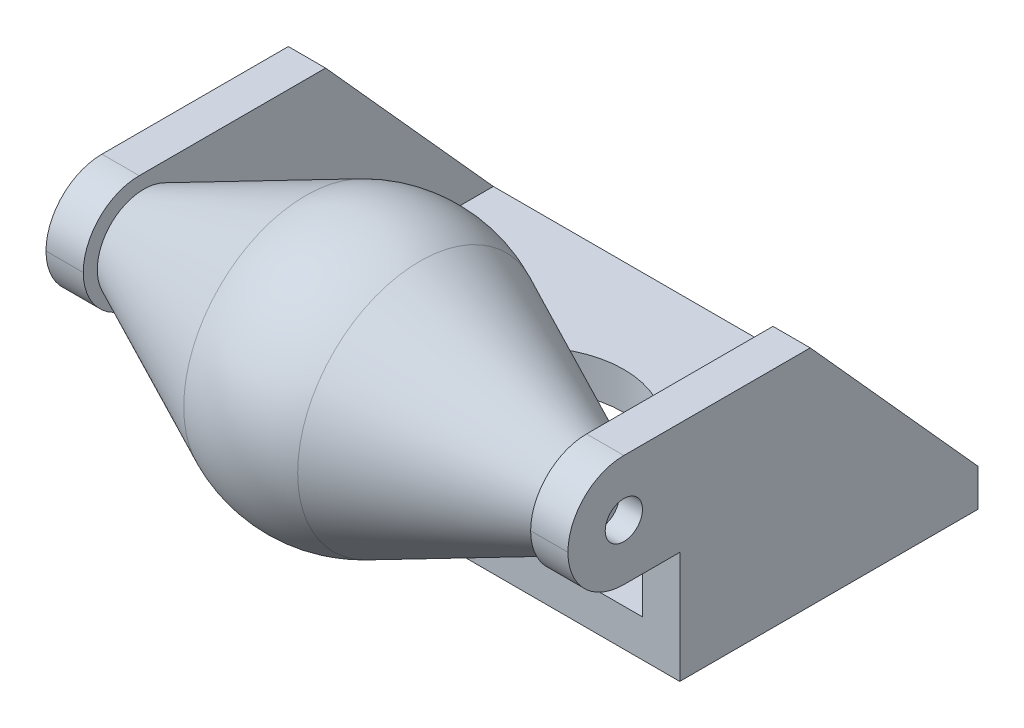
from build123d import *

# Parameters (mm, degrees)
SKETCH_1_W           = 28
SKETCH_1_H           = 16
EXTRUDE_1_DEPTH      = 2
EXTRUDE_2_DEPTH      = 2
FILLET_1_R           = 3
SKETCH_3_R           = 1
CUT_EXTRUDE_1_DEPTH  = 34.526109228
EXTRUDE_3_DEPTH      = 1
EXTRUDE_3_DEPTH_BACK = 25
SKETCH_5_R           = 1
SKETCH_6_R           = 2
SKETCH_6_R_2         = 5
CUT_EXTRUDE_2_DEPTH  = 2


with BuildPart() as part:
    # 草图1 → 凸台-拉伸1 (new body)
    with BuildSketch(Plane(origin=(0, 0, 0), x_dir=(1, 0, 0), z_dir=(0, 1, 0))):
        Rectangle(SKETCH_1_W, SKETCH_1_H)
    extrude(amount=EXTRUDE_1_DEPTH)

    # 草图2 → 凸台-拉伸2 (add)
    with BuildSketch(Plane.ZY.offset(14)):
        Polygon((-8, 0), (-8, 2), (1, 12), (14, 12), (14, 6), (8, 6), (8, 2), (8, 0), align=None)
    extrude_2 = extrude(amount=-EXTRUDE_2_DEPTH)

    # 镜向1: 凸台-拉伸2 across plane
    add(extrude_2.mirror(Plane(origin=(0, 0, 0), x_dir=(0, 0, 1), z_dir=(1, 0, 0))))

    # 圆角1
    fillet_1_edges = [part.edges().sort_by_distance(p)[0] for p in [
        (13, 6, 14),
        (13, 12, 14),
        (-13, 6, 14),
        (-13, 12, 14),
    ]]
    fillet(fillet_1_edges, radius=FILLET_1_R - 0.0001)  # a hair under: the kernel refuses the full size

    # 草图3 → 切除-拉伸1 (cut, through all)
    with BuildSketch(Plane.ZY.offset(14)):
        with Locations((11, 9)):
            Circle(SKETCH_3_R)
    extrude(amount=-CUT_EXTRUDE_1_DEPTH, mode=Mode.SUBTRACT)



with BuildPart() as body_2:
    # 草图4 → 旋转2 (revolve)
    with BuildSketch(Plane(origin=(0, 9, 0), x_dir=(1, 0, 0), z_dir=(0, 1, 0))):
        with BuildLine():
            Line((-11.75, -11), (-11.75, -13.5))
            Line((-11.75, -13.5), (-3.056178347, -17.553995615))
            ThreePointArc((-3.056178347, -17.553995615), (0, -18.231534043), (3.056178347, -17.553995615))
            Line((3.056178347, -17.553995615), (11.75, -13.5))
            Line((11.75, -13.5), (11.75, -11))
            Line((11.75, -11), (-11.75, -11))
        make_face()
    revolve(axis=Axis((14, 9, 11), (-1, 0, 0)))


with BuildPart() as part_1:
    add(part.part)

    add(body_2.part)  # 凸台-拉伸3 merges body 2
    # 草图5 → 凸台-拉伸3 (add, two sides: drawn at the far end of the back side and taken through both)
    with BuildSketch(Plane(origin=(11.75, 0, 0), x_dir=(0, 0, -1), z_dir=(1, 0, 0)).offset(-EXTRUDE_3_DEPTH_BACK)):
        with Locations(Location((-11, 9, 0), (0, 0, 180))):
            Circle(SKETCH_5_R)
    extrude(amount=EXTRUDE_3_DEPTH + EXTRUDE_3_DEPTH_BACK)

    # 草图6 → 切除-拉伸2 (cut)
    with BuildSketch(Plane.XZ):
        with Locations(Location((-8, 2, 0), (0, 0, 270))):
            Circle(SKETCH_6_R)
        with Locations(Location((8, 2, 0), (0, 0, 270))):
            Circle(SKETCH_6_R)
        with Locations(Location((0, 2, 0), (0, 0, 270))):
            Circle(SKETCH_6_R_2)
    extrude(amount=-CUT_EXTRUDE_2_DEPTH, mode=Mode.SUBTRACT)


solid = part_1.part
